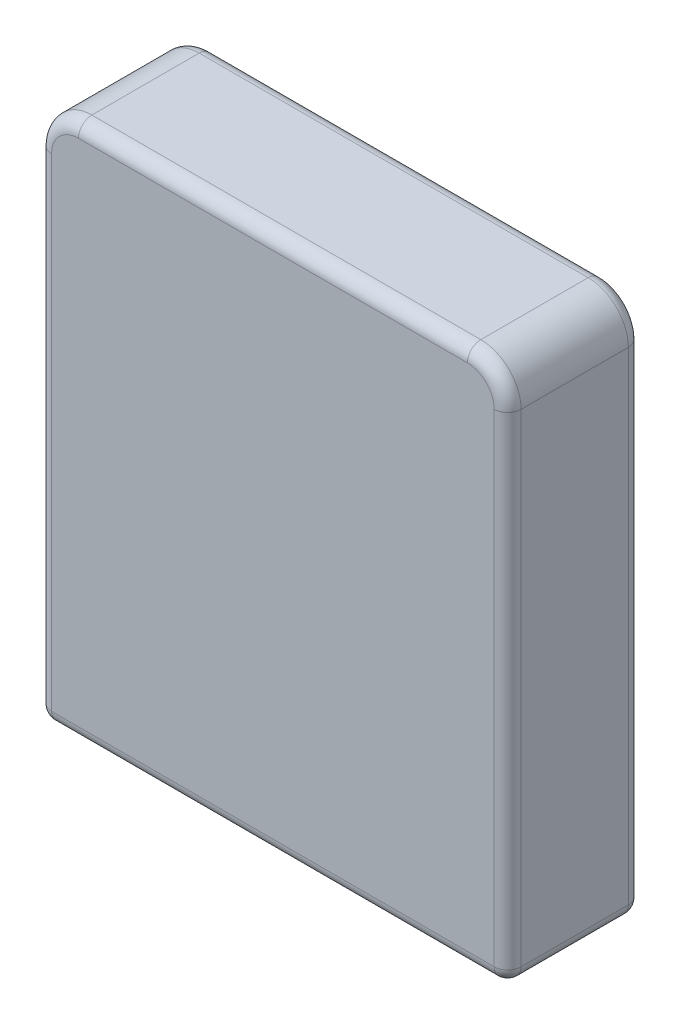
from build123d import *

# Parameters (mm, degrees)
SKETCH1_W           = 35
SKETCH1_H           = 40
BOSS_EXTRUDE1_DEPTH = 10
FILLET1_R           = 3
SKETCH2_W           = 24
SKETCH2_H           = 2
BOSS_EXTRUDE2_DEPTH = 34
FILLET2_R           = 1
FILLET3_R           = 1


with BuildPart() as part:
    # Sketch1 → Boss-Extrude1 (new body)
    with BuildSketch(Plane.XY):
        with Locations((17.5, 20)):
            Rectangle(SKETCH1_W, SKETCH1_H)
    extrude(amount=BOSS_EXTRUDE1_DEPTH)

    # Fillet1
    fillet1_edges = [part.edges().sort_by_distance(p)[0] for p in [
        (0, 40, 5),
        (35, 40, 5),
    ]]
    fillet(fillet1_edges, radius=FILLET1_R)

    # Sketch2 → Boss-Extrude2 (add)
    with BuildSketch(Plane.XZ):
        with Locations((17.5, -1)):
            Rectangle(SKETCH2_W, SKETCH2_H)
    extrude(amount=-BOSS_EXTRUDE2_DEPTH)

    # Fillet2
    fillet2_edges = [part.edges().sort_by_distance(p)[0] for p in [
        (5.5, 34, -1),
        (5.5, 17, -2),
        (17.5, 34, 0),
        (5.5, 17, 0),
        (29.5, 34, -1),
        (29.5, 17, 0),
        (17.5, 34, -2),
        (29.5, 17, -2),
    ]]
    fillet(fillet2_edges, radius=FILLET2_R - 0.0001)  # a hair under: the kernel refuses the full size

    # Fillet3
    fillet3_edges = [part.edges().sort_by_distance(p)[0] for p in [
        (35, 18.5, 10),
        (0, 18.5, 0),
        (0, 18.5, 10),
        (17.5, 40, 0),
        (34.121320344, 39.121320344, 0),
        (0.878679656, 39.121320344, 0),
        (17.5, 40, 10),
        (34.121320344, 39.121320344, 10),
        (0.878679656, 39.121320344, 10),
        (32.74995, 0, 0),
        (17.5, 0, -2),
        (29.207136071, 0, -1.707136071),
        (5.792863929, 0, -1.707136071),
        (5.207136071, 0, -0.292863929),
        (29.792863929, 0, -0.292863929),
        (35, 18.5, 0),
        (2.25005, 0, 0),
        (17.5, 0, 10),
        (35, 0, 5),
        (0, 0, 5),
    ]]
    fillet(fillet3_edges, radius=FILLET3_R - 0.0001)  # a hair under: the kernel refuses the full size


solid = part.part
